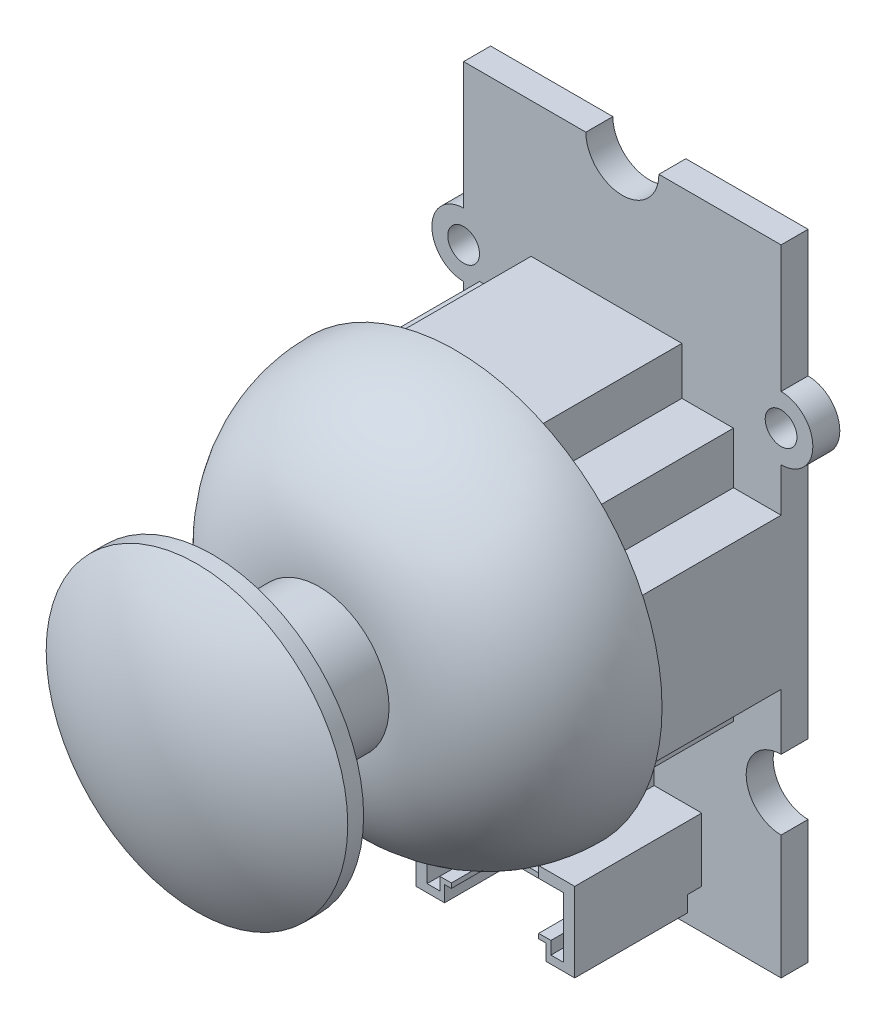
from build123d import *

# Parameters (mm, degrees)
ESQUISSE1_R             = 1
BOSS_EXTRU_1_DEPTH      = 1.7
ESQUISSE2_W             = 10
ESQUISSE2_H             = 5
BOSS_EXTRU_2_DEPTH      = 8
ESQUISSE3_W             = 4
ESQUISSE3_H             = 1.4
ENL_V_MAT_EXTRU_1_DEPTH = 1
CHANFREIN2_SIZE         = 1
ESQUISSE4_W             = 5.5
ESQUISSE4_H             = 3.3
ENL_V_MAT_EXTRU_2_DEPTH = 1
ESQUISSE5_W             = 5.5
ESQUISSE5_H             = 1.5
ENL_V_MAT_EXTRU_3_DEPTH = 11
ENL_V_MAT_EXTRU_4_DEPTH = 7
ESQUISSE7_W             = 6
ESQUISSE7_H             = 6
BOSS_EXTRU_3_DEPTH      = 5
ESQUISSE8_R             = 1.75
BOSS_EXTRU_4_DEPTH      = 1
ESQUISSE9_W             = 16
ESQUISSE9_H             = 16
BOSS_EXTRU_5_DEPTH      = 12
ESQUISSE10_W            = 9.5
ESQUISSE10_H            = 3
ESQUISSE10_W_2          = 3
ESQUISSE10_H_2          = 9.5
BOSS_EXTRU_6_DEPTH      = 12
ESQUISSE12_W            = 32.197385869
ESQUISSE12_H            = 22.732769694
ENL_V_MAT_EXTRU_5_DEPTH = 2.5
ESQUISSE13_R            = 13
BOSS_EXTRU_7_DEPTH      = 8.6
CONG_1_R                = 8.6
ESQUISSE14_R            = 4.4
BOSS_EXTRU_8_DEPTH      = 6.7
ESQUISSE15_R            = 9.5
BOSS_EXTRU_9_DEPTH      = 1
D_ME1_FACE_RADIUS       = 9.5
D_ME1_HEIGHT            = 3
ESQUISSE18_R            = 1.499413023
BOSS_EXTRU_11_DEPTH     = 3.6


with BuildPart() as part:
    # Esquisse1 → Boss.-Extru.1 (new body)
    with BuildSketch(Plane.XY):
        with BuildLine():
            Line((-11.45365733, 20.833333333), (-3.75365733, 20.833333333))
            ThreePointArc((-3.75365733, 20.833333333), (-1.45365733, 18.533333333), (0.84634267, 20.833333333))
            Line((0.84634267, 20.833333333), (8.54634267, 20.833333333))
            Line((8.54634267, 20.833333333), (8.54634267, 12.833333333))
            ThreePointArc((8.54634267, 12.833333333), (10.54634267, 10.833333333), (8.54634267, 8.833333333))
            Line((8.54634267, 8.833333333), (8.54634267, -6.966666667))
            ThreePointArc((8.54634267, -6.966666667), (6.34634267, -9.166666667), (8.54634267, -11.366666667))
            Line((8.54634267, -11.366666667), (8.54634267, -19.166666667))
            Line((8.54634267, -19.166666667), (0.54634267, -19.166666667))
            ThreePointArc((0.54634267, -19.166666667), (-1.45365733, -21.166666667), (-3.45365733, -19.166666667))
            Line((-3.45365733, -19.166666667), (-11.45365733, -19.166666667))
            Line((-11.45365733, -19.166666667), (-11.45365733, -11.366666667))
            ThreePointArc((-11.45365733, -11.366666667), (-9.25365733, -9.166666667), (-11.45365733, -6.966666667))
            Line((-11.45365733, -6.966666667), (-11.45365733, 8.833333333))
            ThreePointArc((-11.45365733, 8.833333333), (-13.45365733, 10.833333333), (-11.45365733, 12.833333333))
            Line((-11.45365733, 12.833333333), (-11.45365733, 20.833333333))
        make_face()
        with Locations((-11.45365733, 10.833333333)):
            Circle(ESQUISSE1_R, mode=Mode.SUBTRACT)
        with Locations((8.54634267, 10.833333333)):
            Circle(ESQUISSE1_R, mode=Mode.SUBTRACT)
        with Locations((-1.45365733, -19.166666667)):
            Circle(ESQUISSE1_R, mode=Mode.SUBTRACT)
    extrude(amount=BOSS_EXTRU_1_DEPTH)

    # Esquisse2 → Boss.-Extru.2 (add)
    with BuildSketch(Plane.XY.offset(1.7)):
        with Locations((-1.45365733, -15.166666667)):
            Rectangle(ESQUISSE2_W, ESQUISSE2_H)
    extrude(amount=BOSS_EXTRU_2_DEPTH)

    # Esquisse3 → Enlèv. mat.-Extru.1 (cut)
    with BuildSketch(Plane.XZ.offset(17.666666667)):
        Polygon((-6.45365733, 1.7), (3.54634267, 1.7), (3.54634267, 2.6), (1.74634267, 2.6), (1.74634267, 9.7), (-4.65365733, 9.7), (-4.65365733, 2.6), (-6.45365733, 2.6), align=None)
        with Locations((-1.45365733, 5.7)):
            Rectangle(ESQUISSE3_W, ESQUISSE3_H, mode=Mode.SUBTRACT)
    extrude(amount=-ENL_V_MAT_EXTRU_1_DEPTH, mode=Mode.SUBTRACT)

    # Chanfrein2
    chanfrein2_edges = [part.edges().sort_by_distance(p)[0] for p in [
        (-1.45365733, -17.666666667, 6.4),
    ]]
    chamfer(chanfrein2_edges, length=CHANFREIN2_SIZE - 0.0001)  # a hair under: the kernel refuses the full size

    # Esquisse4 → Enlèv. mat.-Extru.2 (cut)
    with BuildSketch(Plane.XZ.offset(16.666666667)):
        with Locations((-1.476758853, 8.05)):
            Rectangle(ESQUISSE4_W, ESQUISSE4_H)
    extrude(amount=-ENL_V_MAT_EXTRU_2_DEPTH, mode=Mode.SUBTRACT)

    # Esquisse5 → Enlèv. mat.-Extru.3 (cut)
    with BuildSketch(Plane.XZ.offset(15.666666667)):
        with Locations((-1.476758853, 8.95)):
            Rectangle(ESQUISSE5_W, ESQUISSE5_H)
    extrude(amount=-ENL_V_MAT_EXTRU_3_DEPTH, mode=Mode.SUBTRACT)

    # Esquisse6 → Enlèv. mat.-Extru.4 (cut)
    with BuildSketch(Plane.XY.offset(9.7)):
        Polygon((-5.75365733, -13.366666667), (2.84634267, -13.366666667), (2.84634267, -16.366666667), (2.84634267, -17.166666667), (2.04634267, -17.166666667), (2.04634267, -16.366666667), (-4.95365733, -16.366666667), (-4.95365733, -17.166666667), (-5.75365733, -17.166666667), (-5.75365733, -16.366666667), align=None)
    extrude(amount=-ENL_V_MAT_EXTRU_4_DEPTH, mode=Mode.SUBTRACT)

    # Esquisse7 → Boss.-Extru.3 (add)
    with BuildSketch(Plane.XY.offset(1.7)):
        with Locations((-2.45365733, -9.666666667)):
            Rectangle(ESQUISSE7_W, ESQUISSE7_H)
    extrude(amount=BOSS_EXTRU_3_DEPTH)

    # Esquisse8 → Boss.-Extru.4 (add)
    with BuildSketch(Plane.XY.offset(6.7)):
        with Locations(Location((-2.45365733, -9.666666667, 0), (0, 0, 180))):
            Circle(ESQUISSE8_R)
    extrude(amount=BOSS_EXTRU_4_DEPTH)

    # Esquisse9 → Boss.-Extru.5 (add)
    with BuildSketch(Plane.XY.offset(1.7)):
        with Locations((-2.45365733, 1.333333333)):
            Rectangle(ESQUISSE9_W, ESQUISSE9_H)
    extrude(amount=BOSS_EXTRU_5_DEPTH)

    # Esquisse10 → Boss.-Extru.6 (add)
    with BuildSketch(Plane.XY.offset(1.7)):
        with Locations((-2.45365733, 10.833333333)):
            Rectangle(ESQUISSE10_W, ESQUISSE10_H)
        with Locations((7.04634267, 1.333333333)):
            Rectangle(ESQUISSE10_W_2, ESQUISSE10_H_2)
    extrude(amount=BOSS_EXTRU_6_DEPTH)

    # Esquisse12 → Enlèv. mat.-Extru.5 (cut)
    with BuildSketch(Plane.XY.offset(13.7)):
        with Locations((-0.834476833, 3.194598891)):
            Rectangle(ESQUISSE12_W, ESQUISSE12_H)
    extrude(amount=-ENL_V_MAT_EXTRU_5_DEPTH, mode=Mode.SUBTRACT)

    # Esquisse13 → Boss.-Extru.7 (add)
    with BuildSketch(Plane.XY.offset(11.2)):
        with Locations(Location((-2.45365733, 1.333333333, 0), (0, 0, 180))):
            Circle(ESQUISSE13_R)
    extrude(amount=BOSS_EXTRU_7_DEPTH)

    # Congé1
    cong_1_edges = [part.edges().sort_by_distance(p)[0] for p in [
        (10.54634267, 1.333333333, 19.8),
    ]]
    fillet(cong_1_edges, radius=CONG_1_R - 0.0001)  # a hair under: the kernel refuses the full size

    # Esquisse14 → Boss.-Extru.8 (add)
    with BuildSketch(Plane.XY.offset(19.8)):
        with Locations((-2.45365733, 1.333333333)):
            Circle(ESQUISSE14_R)
    extrude(amount=BOSS_EXTRU_8_DEPTH)

    # Esquisse15 → Boss.-Extru.9 (add)
    with BuildSketch(Plane.XY.offset(26.5)):
        with Locations((-2.45365733, 1.333333333)):
            Circle(ESQUISSE15_R)
    extrude(amount=BOSS_EXTRU_9_DEPTH)

    # Dôme1: a dome of height H over a round flat face of radius A is a cap of a sphere of radius (A * A + H * H) / (2 * H)
    d_me1_r = (D_ME1_FACE_RADIUS * D_ME1_FACE_RADIUS + D_ME1_HEIGHT * D_ME1_HEIGHT) / (2 * D_ME1_HEIGHT)
    d_me1_base = Plane((-2.45365733, 1.333333333, 27.5), z_dir=(0, 0, 1))
    with Locations(d_me1_base.offset(D_ME1_HEIGHT - d_me1_r)):
        d_me1_ball = Sphere(d_me1_r, mode=Mode.PRIVATE)
    add(split(d_me1_ball, bisect_by=d_me1_base, keep=Keep.TOP, mode=Mode.PRIVATE))


with BuildPart() as body_2:
    # Esquisse18 → Boss.-Extru.11 (new body)
    with BuildSketch(Plane.XZ.offset(6.666666667)):
        with Locations(Location((-2.45365733, 9.199413023, 0), (0, 0, 270))):
            Circle(ESQUISSE18_R)
    extrude(amount=BOSS_EXTRU_11_DEPTH)


solid = Compound([part.part, body_2.part])
